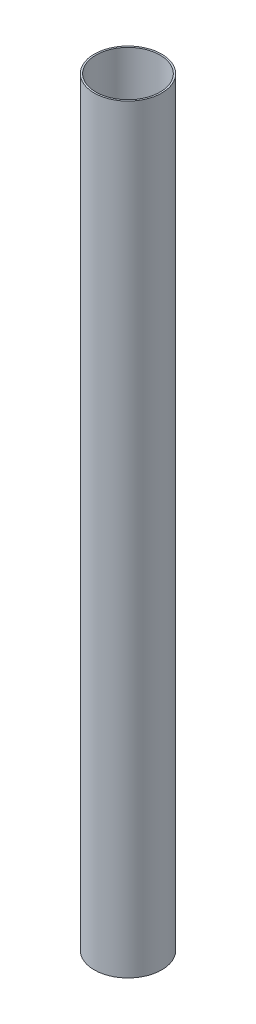
from build123d import *

# Parameters (mm, degrees)
SKETCH1_R   = 25.4
SKETCH1_R_2 = 24.1554
BODY_DEPTH  = 571.5
SKETCH2_W   = 1.87325
SKETCH2_H   = 1.7272


with BuildPart() as part:
    # Sketch1 → body (new body)
    with BuildSketch(Plane(origin=(0, 0, 0), x_dir=(1, 0, 0), z_dir=(0, 1, 0))):
        Circle(SKETCH1_R)
        Circle(SKETCH1_R_2, mode=Mode.SUBTRACT)
    extrude(amount=BODY_DEPTH)

    # Sketch2 → Cut-Revolve1 (revolve, cut)
    with BuildSketch(Plane.XY):
        with Locations((23.955375, 7.2136)):
            Rectangle(SKETCH2_W, SKETCH2_H)
    revolve(axis=Axis((0, 0, 0), (0, 1, 0)), mode=Mode.SUBTRACT)


solid = part.part
